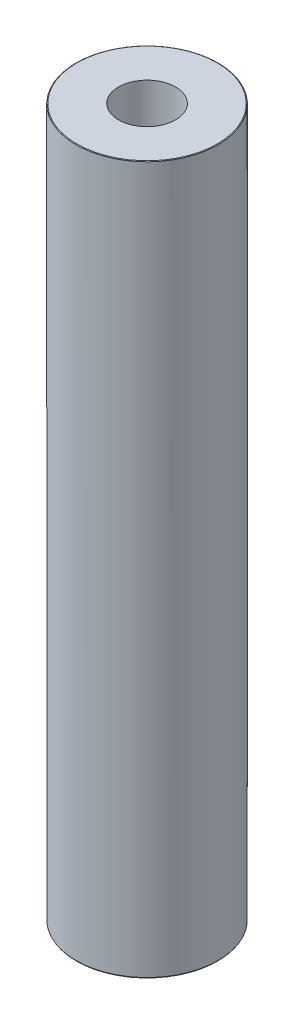
from build123d import *
from OCP.BRepFilletAPI import BRepFilletAPI_MakeChamfer

# Parameters (mm, degrees)
SKETCH1_R           = 47.5
BOSS_EXTRUDE1_DEPTH = 473.557068125
SKETCH2_R           = 19.094009059
CUT_EXTRUDE1_DEPTH  = 479.297811798
CHAMFER1_SIZE       = 0.281647289
CHAMFER1_SIZE2      = 0.487827414


with BuildPart() as part:
    # Sketch1 → Boss-Extrude1 (new body)
    with BuildSketch(Plane(origin=(0, 0, 0), x_dir=(1, 0, 0), z_dir=(0, 1, 0))):
        Circle(SKETCH1_R)
    extrude(amount=BOSS_EXTRUDE1_DEPTH)

    # Sketch2 → Cut-Extrude1 (cut, through all)
    with BuildSketch(Plane(origin=(0, 0, 0), x_dir=(1, 0, 0), z_dir=(0, 1, 0))):
        Circle(SKETCH2_R)
    extrude(amount=CUT_EXTRUDE1_DEPTH, mode=Mode.SUBTRACT)

    # Chamfer1: one chamfer whose edges measure the first distance from different faces: ONE call of the kernel's chamfer builder (chamfer() names one face for all edges)
    chamfer1_edges_1 = [part.edges().sort_by_distance(p)[0] for p in [
        (-47.5, 473.557068125, 0),
    ]]
    chamfer1_side_1 = [part.faces().sort_by_distance(p)[0] for p in [
        (-47.5, 236.778534062, 0),
    ]]
    chamfer1_edges_2 = [part.edges().sort_by_distance(p)[0] for p in [
        (-47.5, 0, 0),
    ]]
    chamfer1_side_2 = [part.faces().sort_by_distance(p)[0] for p in [
        (-46.156497116, 0, 0),
    ]]
    chamfer1 = BRepFilletAPI_MakeChamfer(part.part.solid().wrapped)
    for e in chamfer1_edges_1:
        chamfer1.Add(CHAMFER1_SIZE, CHAMFER1_SIZE2, e.wrapped, chamfer1_side_1[0].wrapped)  # the first distance lies on this face
    for e in chamfer1_edges_2:
        chamfer1.Add(CHAMFER1_SIZE, CHAMFER1_SIZE2, e.wrapped, chamfer1_side_2[0].wrapped)  # the first distance lies on this face
    add(Compound.cast(chamfer1.Shape()), mode=Mode.REPLACE)


solid = part.part
